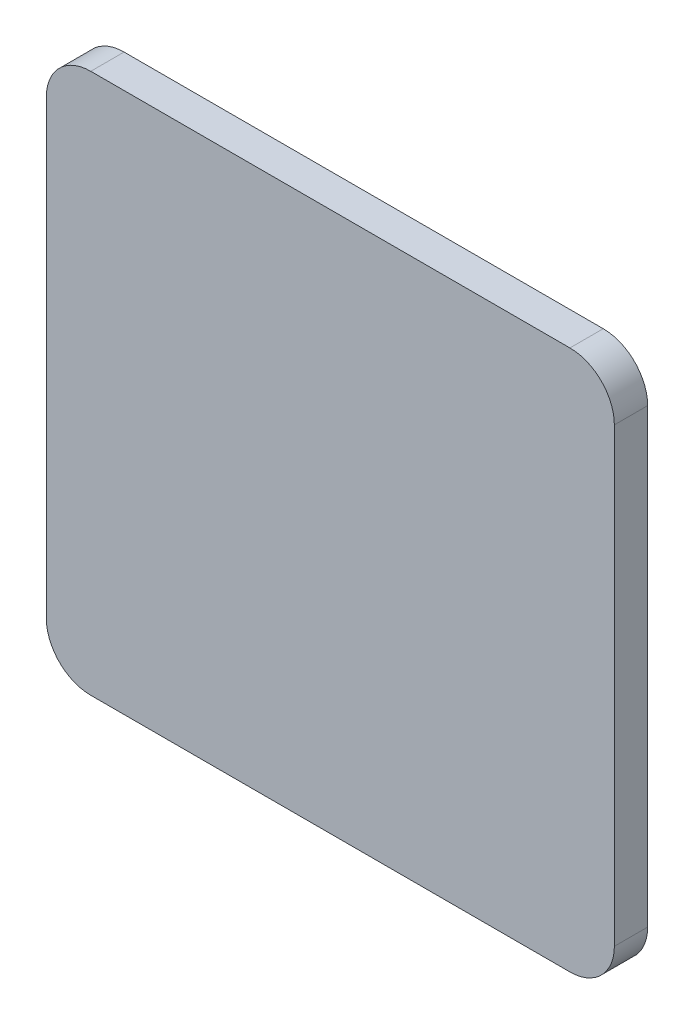
from build123d import *

# Parameters (mm, degrees)
SKETCH1_W           = 25.574997544
SKETCH1_H           = 24.331915792
BOSS_EXTRUDE1_DEPTH = 1.5
FILLET2_R           = 2


with BuildPart() as part:
    # Sketch1 → Boss-Extrude1 (new body)
    with BuildSketch(Plane.XY):
        with Locations((12.787498772, 12.165957896)):
            Rectangle(SKETCH1_W, SKETCH1_H)
    extrude(amount=BOSS_EXTRUDE1_DEPTH)

    # Fillet2
    fillet2_edges = [part.edges().sort_by_distance(p)[0] for p in [
        (25.574997544, 0, 0.75),
        (25.574997544, 24.331915792, 0.75),
        (0, 0, 0.75),
        (0, 24.331915792, 0.75),
    ]]
    fillet(fillet2_edges, radius=FILLET2_R)


solid = part.part
